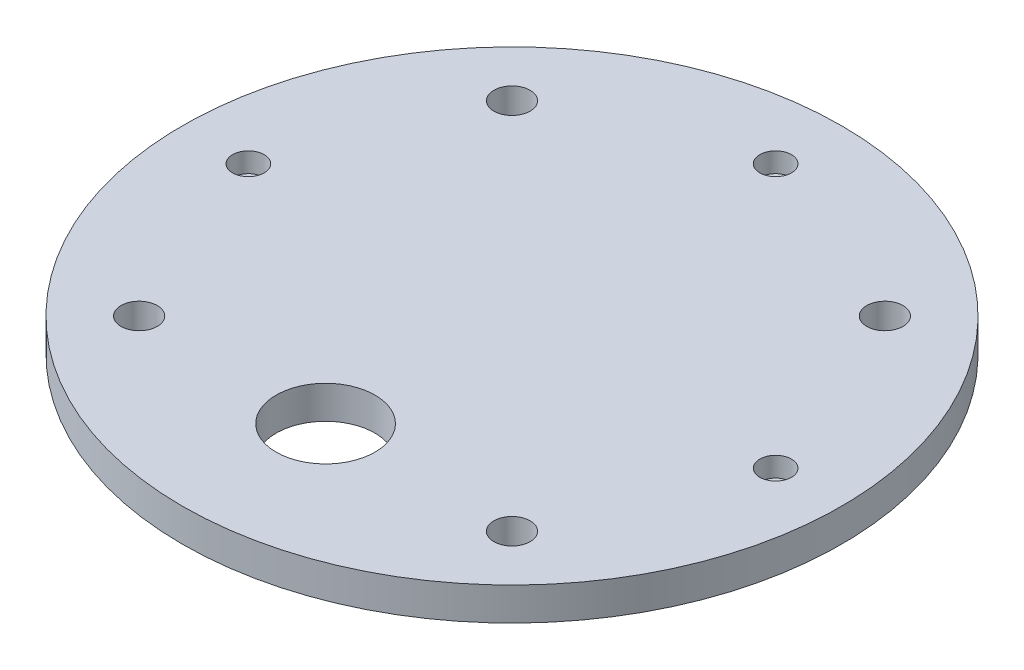
from build123d import *

# Parameters (mm, degrees)
SKETCH_1_R          = 50
EXTRUDE_1_DEPTH     = 5
SKETCH_5_R          = 2.75
CUT_EXTRUDE_4_DEPTH = 24
SKETCH_6_R          = 7.5
CUT_EXTRUDE_5_DEPTH = 24
SKETCH_7_R          = 2.4
CUT_EXTRUDE_6_DEPTH = 3


with BuildPart() as part:
    # 草图1 → 凸台-拉伸1 (new body)
    with BuildSketch(Plane(origin=(0, 0, 0), x_dir=(1, 0, 0), z_dir=(0, 1, 0))):
        Circle(SKETCH_1_R)
    extrude(amount=-EXTRUDE_1_DEPTH)

    # 草图5 → 切除-拉伸4 (cut)
    with BuildSketch(Plane(origin=(0, 0, 0), x_dir=(1, 0, 0), z_dir=(0, 1, 0))):
        with Locations((28.284271247, 28.284271247)):
            Circle(SKETCH_5_R)
        with Locations((28.284271247, -28.284271247)):
            Circle(SKETCH_5_R)
        with Locations((-28.284271247, -28.284271247)):
            Circle(SKETCH_5_R)
        with Locations((-28.284271247, 28.284271247)):
            Circle(SKETCH_5_R)
    extrude(amount=-CUT_EXTRUDE_4_DEPTH, mode=Mode.SUBTRACT)

    # 草图6 → 切除-拉伸5 (cut)
    with BuildSketch(Plane(origin=(0, 0, 0), x_dir=(1, 0, 0), z_dir=(0, 1, 0))):
        with Locations((0, -28.284271247)):
            Circle(SKETCH_6_R)
    extrude(amount=-CUT_EXTRUDE_5_DEPTH, mode=Mode.SUBTRACT)

    # 草图7 → 切除-拉伸6 (cut)
    with BuildSketch(Plane(origin=(0, 0, 0), x_dir=(1, 0, 0), z_dir=(0, 1, 0))):
        with Locations((40, 0)):
            Circle(SKETCH_7_R)
        with Locations((0, 40)):
            Circle(SKETCH_7_R)
        with Locations((-40, 0)):
            Circle(SKETCH_7_R)
    extrude(amount=-CUT_EXTRUDE_6_DEPTH, mode=Mode.SUBTRACT)


solid = part.part
